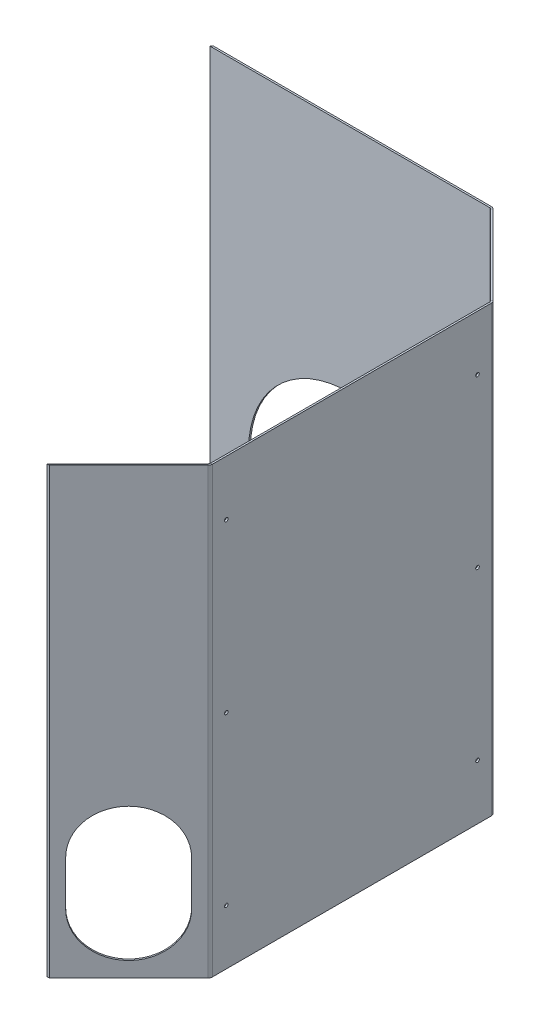
from build123d import *

# Parameters (mm, degrees)
BASE_FLANGE1_DEPTH   = 997
CUT_EXTRUDE1_DEPTH   = 10
SKETCH7_R            = 225
CUT_EXTRUDE2_DEPTH   = 10
SKETCH8_R            = 4
CUT_EXTRUDE3_DEPTH   = 10
CUT_EXTRUDE4_DEPTH   = 10
LPATTERN1_COUNT      = 3
LPATTERN1_PITCH      = 375
LPATTERN1_COUNT_DIR2 = 2
LPATTERN1_PITCH_DIR2 = 564.02
CHAMFER1_SIZE        = 4


# Sheet-metal steps are written as plain solids
with BuildPart() as part:
    # Sketch1 → Base-Flange1 (new body)
    with BuildSketch(Plane(origin=(0, 0, 0), x_dir=(1, 0, 0), z_dir=(0, 1, 0))):
        with BuildLine():
            Line((116.152236891, -603), (297.071067812, -422.08116908))
            ThreePointArc((297.071067812, -422.08116908), (299.238795325, -418.836935591), (300, -415.010101268))
            Line((300, -415.010101268), (300, 211.010101268))
            ThreePointArc((300, 211.010101268), (299.238795325, 214.836935591), (297.071067812, 218.08116908))
            Line((297.071067812, 218.08116908), (119.08116908, 396.071067812))
            ThreePointArc((119.08116908, 396.071067812), (115.836935591, 398.238795325), (112.010101268, 399))
            Line((112.010101268, 399), (-516, 399))
            Line((-516, 399), (-516, 395))
            Line((-516, 395), (112.010101268, 395))
            ThreePointArc((112.010101268, 395), (114.306201862, 394.543277195), (116.252741955, 393.242640687))
            Line((116.252741955, 393.242640687), (294.242640687, 215.252741955))
            ThreePointArc((294.242640687, 215.252741955), (295.543277195, 213.306201862), (296, 211.010101268))
            Line((296, 211.010101268), (296, -415.010101268))
            ThreePointArc((296, -415.010101268), (295.543277195, -417.306201862), (294.242640687, -419.252741955))
            Line((294.242640687, -419.252741955), (113.323809767, -600.171572875))
            Line((113.323809767, -600.171572875), (116.152236891, -603))
        make_face()
    extrude(amount=BASE_FLANGE1_DEPTH)

    # Sketch6 → Cut-Extrude1 (cut)
    with BuildSketch(Plane(origin=(257.576118446, 0, -257.576118446), x_dir=(-0.7071067811865485, 0, -0.7071067811865466), z_dir=(0.7071067811865466, 0, -0.7071067811865485))):
        with BuildLine():
            Line((-30.138564286, 134), (-30.138564286, 234))
            ThreePointArc((-30.138564286, 234), (69.861435714, 334), (169.861435714, 234))
            Line((169.861435714, 234), (169.861435714, 134))
            ThreePointArc((169.861435714, 134), (69.861435714, 34), (-30.138564286, 134))
        make_face()
    extrude(amount=-CUT_EXTRUDE1_DEPTH, mode=Mode.SUBTRACT)

    # Sketch7 → Cut-Extrude2 (cut)
    with BuildSketch(Plane(origin=(0, 0, -399), x_dir=(-1, 0, 0), z_dir=(0, 0, -1))):
        with Locations((204, 255)):
            Circle(SKETCH7_R)
    extrude(amount=-CUT_EXTRUDE2_DEPTH, mode=Mode.SUBTRACT)

    # Sketch8 → Cut-Extrude3 (cut)
    with BuildSketch(Plane(origin=(300, 0, 0), x_dir=(0, 0, -1), z_dir=(1, 0, 0))):
        with Locations((180.010101268, 873.5)):
            Circle(SKETCH8_R)
    cut_extrude3 = extrude(amount=-CUT_EXTRUDE3_DEPTH, mode=Mode.SUBTRACT)

    # Sketch9 → Cut-Extrude4 (cut)
    with BuildSketch(Plane(origin=(359.576118446, 0, 359.576118446), x_dir=(0.7071067811865415, 0, -0.7071067811865536), z_dir=(0.7071067811865536, 0, 0.7071067811865415))):
        with BuildLine():
            Line((-314.395490323, 134), (-314.395490323, 234))
            ThreePointArc((-314.395490323, 234), (-214.395490323, 334), (-114.395490323, 234))
            Line((-114.395490323, 234), (-114.395490323, 134))
            ThreePointArc((-114.395490323, 134), (-214.395490323, 34), (-314.395490323, 134))
        make_face()
    extrude(amount=-CUT_EXTRUDE4_DEPTH, mode=Mode.SUBTRACT)

    # LPattern1: Cut-Extrude3 3 × 2
    with Locations(*[(0, -i * LPATTERN1_PITCH, j * LPATTERN1_PITCH_DIR2) for i in range(LPATTERN1_COUNT) for j in range(LPATTERN1_COUNT_DIR2) if (i, j) != (0, 0)]):
        add(cut_extrude3, mode=Mode.SUBTRACT)

    # Chamfer1
    chamfer1_edges = [part.edges().sort_by_distance(p)[0] for p in [
        (-516, 498.5, -399),
        (116.152236891, 498.5, 603),
    ]]
    chamfer(chamfer1_edges, length=CHAMFER1_SIZE - 0.0001)  # a hair under: the kernel refuses the full size


solid = part.part
